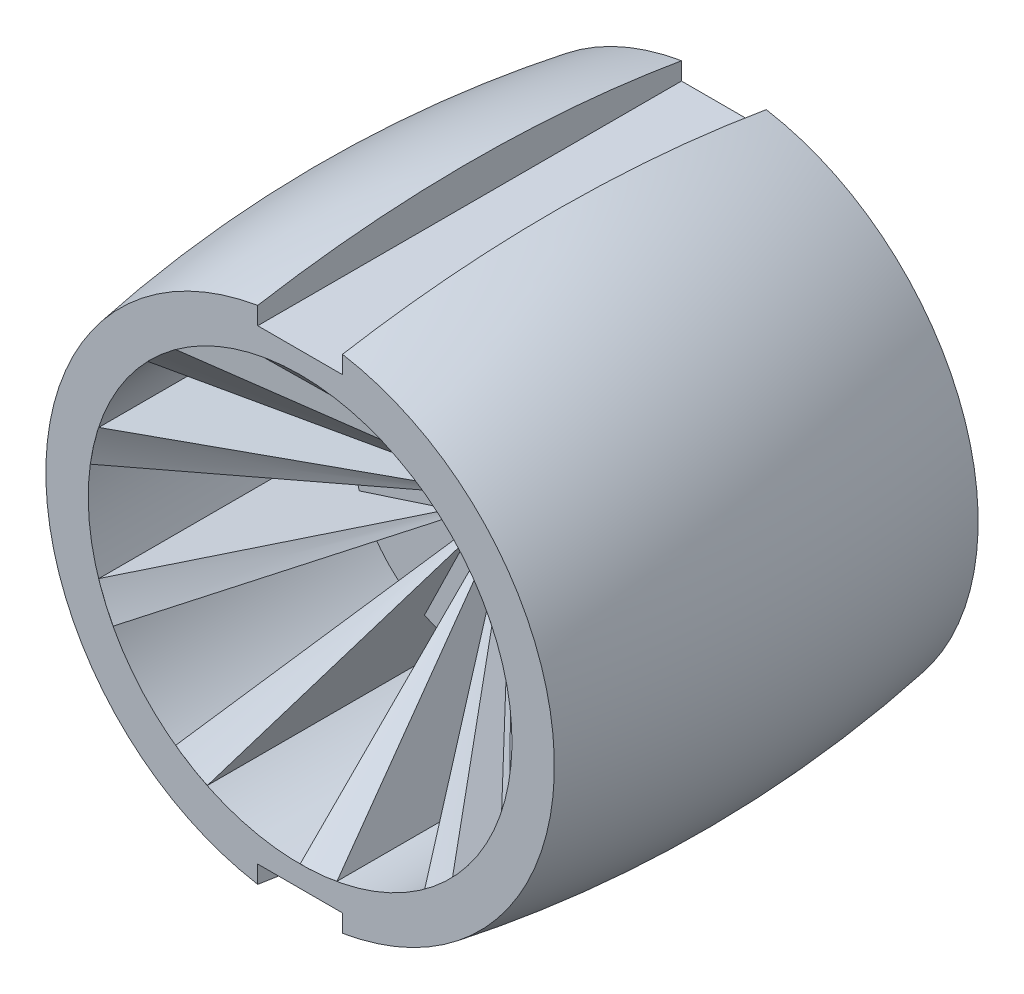
from build123d import *

# Parameters (mm, degrees)
SKETCH4_R           = 15
SKETCH4_R_2         = 3.75
BOSS_EXTRUDE1_DEPTH = 3.75
REVOLVE1_ANGLE      = 10
CIRPATTERN1_COUNT   = 10
SKETCH7_W           = 10
SKETCH7_H           = 7.5
CUT_EXTRUDE1_DEPTH  = 52.822426825


with BuildPart() as part:
    # Sweep1: sweep along a path in Sketch3
    with BuildLine(Plane.XY) as sweep1_path:
        CenterArc((0, 0), 30, 0, 360)
    # Sketch1 → Sweep1 (sweep)
    with BuildSketch(Plane(origin=(0, 0, 0), x_dir=(0, 0, -1), z_dir=(1, 0, 0))):
        with BuildLine():
            Line((-25, 30), (-25, 25))
            Line((-25, 25), (25, 25))
            Line((25, 25), (25, 30))
            ThreePointArc((25, 30), (0, 32.098005423), (-25, 30))
        make_face()
    sweep(path=sweep1_path.line)

    # Sketch7 → Cut-Extrude1 (cut, symmetric)
    with BuildSketch(Plane.XY):
        with Locations((0, 31.25)):
            Rectangle(SKETCH7_W, SKETCH7_H)
    cut_extrude1 = extrude(amount=CUT_EXTRUDE1_DEPTH, both=True, mode=Mode.SUBTRACT)

    # Mirror1: Cut-Extrude1 across plane
    add(cut_extrude1.mirror(Plane.ZX), mode=Mode.SUBTRACT)


with BuildPart() as body_2:
    # Sketch4 → Boss-Extrude1 (new, symmetric)
    with BuildSketch(Plane.XY):
        Circle(SKETCH4_R)
        Circle(SKETCH4_R_2, mode=Mode.SUBTRACT)
    extrude(amount=BOSS_EXTRUDE1_DEPTH, both=True)

    # Sketch6 → Revolve1 (revolve)
    with BuildSketch(Plane(origin=(0, 0, 0), x_dir=(0, 0, -1), z_dir=(1, 0, 0))):
        Polygon((-25, 25), (25, 25), (3.75, 3.75), (3.75, 15), (-3.75, 15), (-3.75, 3.75), align=None)
    revolve1 = revolve(axis=Axis((0, 0, -26.331150218), (0, 0, 1)), revolution_arc=REVOLVE1_ANGLE)

    # CirPattern1: Revolve1 ×10 about axis
    cirpattern1_axis = Axis((0, 0, -26.331150218), (0, 0, 1))
    for i in range(1, CIRPATTERN1_COUNT):
        add(revolve1.rotate(cirpattern1_axis, i * 360 / CIRPATTERN1_COUNT))


solid = Compound([part.part, body_2.part])
